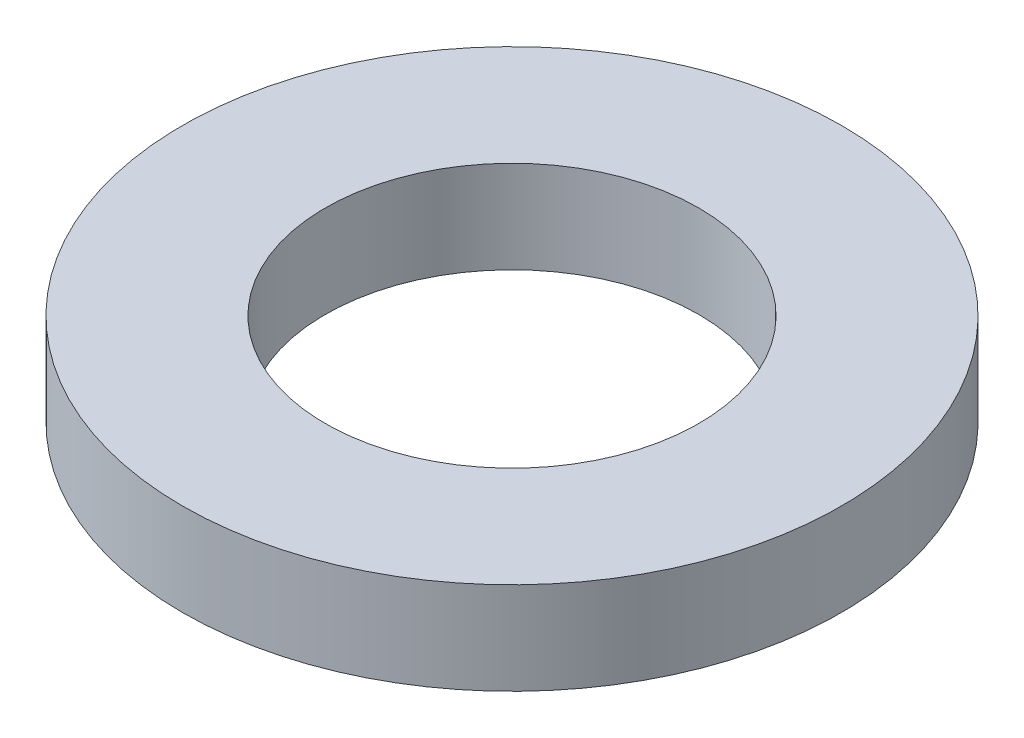
from build123d import *

# Parameters (mm, degrees)
SKETCH1_R           = 75
BOSS_EXTRUDE1_DEPTH = 21
SKETCH2_R           = 42.5
CUT_EXTRUDE1_DEPTH  = 109.124927746


with BuildPart() as part:
    # Sketch1 → Boss-Extrude1 (new body)
    with BuildSketch(Plane(origin=(0, 0, 0), x_dir=(1, 0, 0), z_dir=(0, 1, 0))):
        Circle(SKETCH1_R)
    extrude(amount=BOSS_EXTRUDE1_DEPTH)

    # Sketch2 → Cut-Extrude1 (cut, through all)
    with BuildSketch(Plane(origin=(0, 0, 0), x_dir=(1, 0, 0), z_dir=(0, 1, 0))):
        Circle(SKETCH2_R)
    extrude(amount=CUT_EXTRUDE1_DEPTH, mode=Mode.SUBTRACT)


solid = part.part
